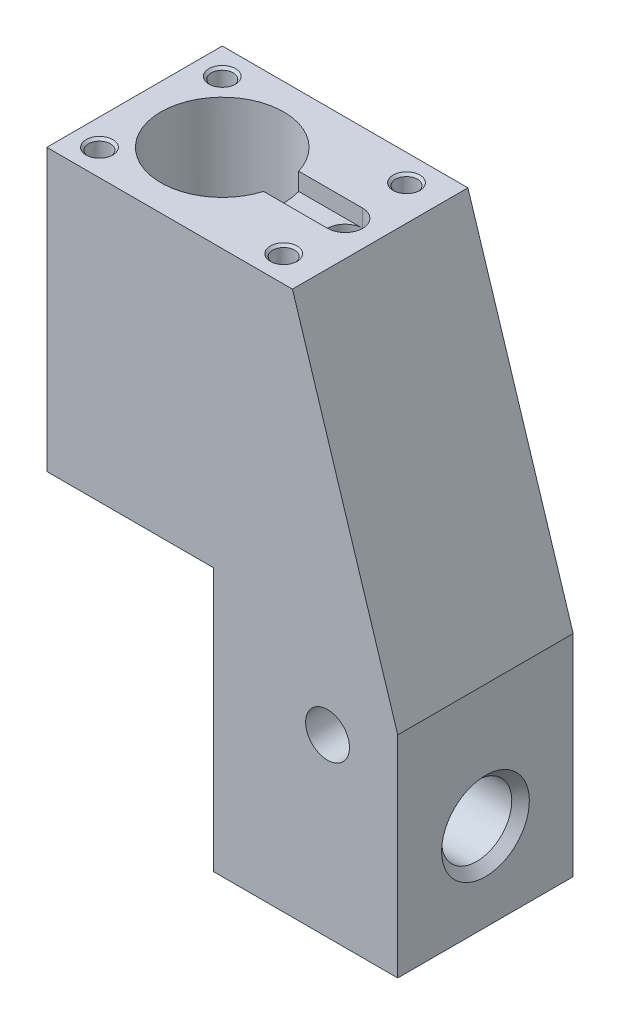
from build123d import *

# Parameters (mm, degrees)
BOSS_EXTRUDE1_DEPTH         = 10
CUT_EXTRUDE1_DEPTH          = 67.219332525
CUT_EXTRUDE2_DEPTH          = 2
M3_TAPPED_HOLE1_D           = 2.5
M3_TAPPED_HOLE1_DEPTH       = 9
M3_TAPPED_HOLE1_CSINK_D     = 3.05
M3_TAPPED_HOLE1_CSINK_ANGLE = 90
M3_TAPPED_HOLE1_TIP         = 0.751075774
SKETCH6_R                   = 2.5
CUT_EXTRUDE3_DEPTH          = 44.185645763
SKETCH7_R                   = 4
CUT_EXTRUDE4_DEPTH          = 53.191953403
CHAMFER1_SIZE               = 1
CUT_EXTRUDE5_REACH          = 54.192
CUT_EXTRUDE5_END_RADIUS     = 7
SKETCH12_R                  = 1.6
M4_TAPPED_HOLE1_REACH       = 68.219
M4_TAPPED_HOLE1_BORE_R      = 1.65
CUT_EXTRUDE6_REACH          = 68.219
CUT_EXTRUDE6_END_RADIUS     = 2.5
SKETCH15_R                  = 1.25


# Read off the part's stored shape, not the designer's step: Hole2
with BuildPart() as part:
    # Sketch1 → Boss-Extrude1 (new, symmetric)
    with BuildSketch(Plane.XY):
        Polygon((0, 0), (-19, 0), (-19, 32), (9, 32), (21, -6), (21, -30), (0, -30), align=None)
    extrude(amount=BOSS_EXTRUDE1_DEPTH, both=True)

    # Sketch2 → Cut-Extrude1 (cut, through all)
    with BuildSketch(Plane(origin=(0, 32, 0), x_dir=(1, 0, 0), z_dir=(0, 1, 0))):
        with BuildLine():
            ThreePointArc((-2.291796068, 2), (-10.010587075, 6.926666858), (-16, 0))
            Line((-16, 0), (-2, 0))
            ThreePointArc((-2, 0), (-2.073333142, 1.010587075), (-2.291796068, 2))
        make_face()
        with BuildLine():
            Line((-2, 0), (-16, 0))
            ThreePointArc((-16, 0), (-10.010587075, -6.926666858), (-2.291796068, -2))
            ThreePointArc((-2.291796068, -2), (-2.073333142, -1.010587075), (-2, 0))
        make_face()
    extrude(amount=-CUT_EXTRUDE1_DEPTH, mode=Mode.SUBTRACT)

    # Sketch2<3> → Cut-Extrude2 (cut)
    with BuildSketch(Plane(origin=(0, 32, 0), x_dir=(1, 0, 0), z_dir=(0, 1, 0))):
        with BuildLine():
            ThreePointArc((-2.291796068, 2), (-2.073333142, 1.010587075), (-2, 0))
            Line((-2, 0), (3, 0))
            ThreePointArc((3, 0), (3.585786438, 1.414213562), (5, 2))
            Line((5, 2), (-2.291796068, 2))
        make_face()
        with BuildLine():
            Line((3, 0), (-2, 0))
            ThreePointArc((-2, 0), (-2.073333142, -1.010587075), (-2.291796068, -2))
            Line((-2.291796068, -2), (5, -2))
            ThreePointArc((5, -2), (3.585786438, -1.414213562), (3, 0))
        make_face()
        with BuildLine():
            ThreePointArc((5, 2), (3.585786438, 1.414213562), (3, 0))
            Line((3, 0), (7, 0))
            ThreePointArc((7, 0), (6.414213562, 1.414213562), (5, 2))
        make_face()
        with BuildLine():
            Line((7, 0), (3, 0))
            ThreePointArc((3, 0), (3.585786438, -1.414213562), (5, -2))
            ThreePointArc((5, -2), (6.414213562, -1.414213562), (7, 0))
        make_face()
    extrude(amount=-CUT_EXTRUDE2_DEPTH, mode=Mode.SUBTRACT)

    # M3 Tapped Hole1
    with Locations(Plane(origin=(0, 32, 0), x_dir=(1, 0, 0), z_dir=(0, 1, 0))):
        with Locations((-16, 7), (-16, -7), (5, -7), (5, 7)):
            CounterSinkHole(M3_TAPPED_HOLE1_D / 2, M3_TAPPED_HOLE1_CSINK_D / 2, depth=M3_TAPPED_HOLE1_DEPTH, counter_sink_angle=M3_TAPPED_HOLE1_CSINK_ANGLE)
            with Locations((0, 0, -(M3_TAPPED_HOLE1_DEPTH + M3_TAPPED_HOLE1_TIP / 2))):  # 118° drill point
                Cone(0, M3_TAPPED_HOLE1_D / 2, M3_TAPPED_HOLE1_TIP, mode=Mode.SUBTRACT)

    # Sketch6 → Cut-Extrude3 (cut, through all)
    with BuildSketch(Plane.XY.offset(10)):
        with Locations((13, -10)):
            Circle(SKETCH6_R)
    extrude(amount=-CUT_EXTRUDE3_DEPTH, mode=Mode.SUBTRACT)

    # Sketch7 → Cut-Extrude4 (cut, through all)
    with BuildSketch(Plane(origin=(21, 0, 0), x_dir=(0, 0, -1), z_dir=(1, 0, 0))):
        with Locations(Location((0, -20, 0), (0, 0, 90))):
            Circle(SKETCH7_R)
    extrude(amount=-CUT_EXTRUDE4_DEPTH, mode=Mode.SUBTRACT)

    # Chamfer1
    chamfer1_edges = [part.edges().sort_by_distance(p)[0] for p in [
        (21, -24, 0),
    ]]
    chamfer(chamfer1_edges, length=CHAMFER1_SIZE)

    # Hole2 outline → Hole2 (revolve, cut)
    with BuildSketch(Plane(origin=(5, 0, 0), x_dir=(1, 0, 0), z_dir=(0, 0, 1))):
        Polygon((1.25, 2), (2, 2), (2, 32), (0, 32), (0, -16.200355886), (1.25, -16.200355886), align=None)
    revolve(axis=Axis((5, 0, 0), (0, 1, 0)), mode=Mode.SUBTRACT)

    # Cut-Extrude5: up to this cylinder (the profile starts outside it)
    cut_extrude5_end = Plane(origin=(-9, 15, 0), z_dir=(0, 1, 0)) * Cylinder(CUT_EXTRUDE5_END_RADIUS, 123.384, mode=Mode.PRIVATE)
    # Sketch12 → Cut-Extrude5 (cut, up to the surface)
    with BuildSketch(Plane.ZY.offset(19), mode=Mode.PRIVATE) as cut_extrude5_sk1:
        with Locations(Location((-3, 15, 0), (0, 0, 270))):
            Circle(SKETCH12_R)
    cut_extrude5_tool1 = extrude(cut_extrude5_sk1.sketch, amount=-CUT_EXTRUDE5_REACH, mode=Mode.PRIVATE) - cut_extrude5_end
    add(cut_extrude5_tool1.solids().sort_by_distance((-19, 15, -3))[0], mode=Mode.SUBTRACT)
    # Sketch12 → Cut-Extrude5 (cut, up to the surface)
    with BuildSketch(Plane.ZY.offset(19), mode=Mode.PRIVATE) as cut_extrude5_sk2:
        with Locations(Location((3, 15, 0), (0, 0, 270))):
            Circle(SKETCH12_R)
    cut_extrude5_tool2 = extrude(cut_extrude5_sk2.sketch, amount=-CUT_EXTRUDE5_REACH, mode=Mode.PRIVATE) - cut_extrude5_end
    add(cut_extrude5_tool2.solids().sort_by_distance((-19, 15, 3))[0], mode=Mode.SUBTRACT)

    # M4 Tapped Hole1 bore → M4 Tapped Hole1 (cut, up to next)
    with BuildSketch(Plane(origin=(0, -30, 0), x_dir=(-1, 0, 0), z_dir=(0, -1, 0)), mode=Mode.PRIVATE) as m4_tapped_hole1_sk1:
        with Locations((-13, 0)):
            Circle(M4_TAPPED_HOLE1_BORE_R)
    m4_tapped_hole1_tool1 = extrude(m4_tapped_hole1_sk1.sketch, amount=-M4_TAPPED_HOLE1_REACH, mode=Mode.PRIVATE) & part.part
    # M4 Tapped Hole1 bore → M4 Tapped Hole1 (cut, up to next)
    with BuildSketch(Plane(origin=(0, -30, 0), x_dir=(-1, 0, 0), z_dir=(0, -1, 0)), mode=Mode.PRIVATE) as m4_tapped_hole1_sk2:
        with Locations((-5, 0)):
            Circle(M4_TAPPED_HOLE1_BORE_R)
    m4_tapped_hole1_tool2 = extrude(m4_tapped_hole1_sk2.sketch, amount=-M4_TAPPED_HOLE1_REACH, mode=Mode.PRIVATE) & part.part
    add(m4_tapped_hole1_tool1.solids().sort_by_distance((13, -30, 0))[0], mode=Mode.SUBTRACT)
    add(m4_tapped_hole1_tool2.solids().sort_by_distance((5, -30, 0))[0], mode=Mode.SUBTRACT)

    # Cut-Extrude6: up to this cylinder (the profile starts outside it)
    cut_extrude6_end = Plane(origin=(13, -10, 0), z_dir=(0, 0, 1)) * Cylinder(CUT_EXTRUDE6_END_RADIUS, 142.438, mode=Mode.PRIVATE)
    # Sketch15 → Cut-Extrude6 (cut, up to the surface)
    with BuildSketch(Plane.XZ.offset(30), mode=Mode.PRIVATE) as cut_extrude6_sk1:
        with Locations(Location((13, 0, 0), (0, 0, 270))):
            Circle(SKETCH15_R)
    cut_extrude6_tool1 = extrude(cut_extrude6_sk1.sketch, amount=-CUT_EXTRUDE6_REACH, mode=Mode.PRIVATE) - cut_extrude6_end
    add(cut_extrude6_tool1.solids().sort_by_distance((13, -30, 0))[0], mode=Mode.SUBTRACT)


solid = part.part
